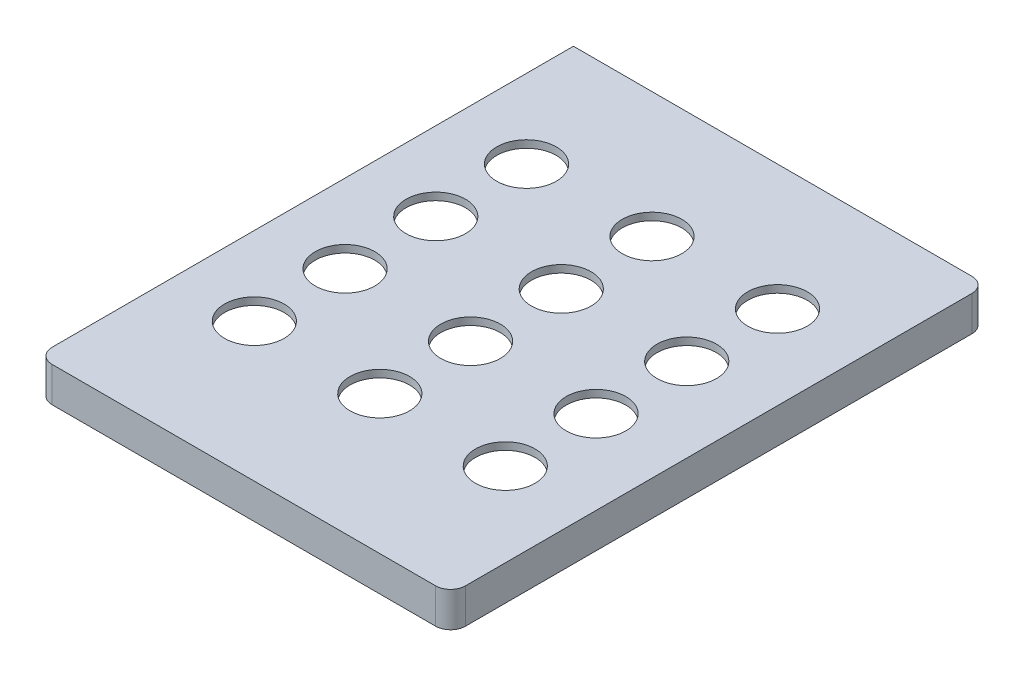
from build123d import *

# Parameters (mm, degrees)
SKETCH11_W          = 51.95
SKETCH11_H          = 64.5
BOSS_EXTRUDE4_DEPTH = 3.7
SKETCH12_R          = 4
BOSS_EXTRUDE5_DEPTH = 1


with BuildPart() as part:
    # Sketch11 → Boss-Extrude4 (new body)
    with BuildSketch(Plane(origin=(0, 12.5, 0), x_dir=(1, 0, 0), z_dir=(0, 1, 0))):
        with BuildLine():
            Line((25.75, 36), (-27.75, 36))
            Line((-27.75, 36), (-27.75, 27.25))
            Line((-27.75, 27.25), (-27.75, 18.75))
            Line((-27.75, 18.75), (-27.75, -34))
            ThreePointArc((-27.75, -34), (-27.164213562, -35.414213562), (-25.75, -36))
            Line((-25.75, -36), (25.75, -36))
            ThreePointArc((25.75, -36), (27.164213562, -35.414213562), (27.75, -34))
            Line((27.75, -34), (27.75, 34))
            ThreePointArc((27.75, 34), (27.164213562, 35.414213562), (25.75, 36))
        make_face()
        with Locations((-0.525, 1.75)):
            Rectangle(SKETCH11_W, SKETCH11_H, mode=Mode.SUBTRACT)
    extrude(amount=BOSS_EXTRUDE4_DEPTH)

    # Sketch12 → Boss-Extrude5 (add)
    with BuildSketch(Plane(origin=(0, 16.2, 0), x_dir=(1, 0, 0), z_dir=(0, 1, 0))):
        with BuildLine():
            Line((-25.75, -36), (25.75, -36))
            ThreePointArc((25.75, -36), (27.164213562, -35.414213562), (27.75, -34))
            Line((27.75, -34), (27.75, 34))
            ThreePointArc((27.75, 34), (27.164213562, 35.414213562), (25.75, 36))
            Line((25.75, 36), (-27.75, 36))
            Line((-27.75, 36), (-27.75, -34))
            ThreePointArc((-27.75, -34), (-27.164213562, -35.414213562), (-25.75, -36))
        make_face()
        with Locations((-17.2, -17.4)):
            Circle(SKETCH12_R, mode=Mode.SUBTRACT)
        with Locations((-17.2, -5.216666667)):
            Circle(SKETCH12_R, mode=Mode.SUBTRACT)
        with Locations((-17.2, 6.966666667)):
            Circle(SKETCH12_R, mode=Mode.SUBTRACT)
        with Locations((-17.2, 19.15)):
            Circle(SKETCH12_R, mode=Mode.SUBTRACT)
        with Locations((-0.35, 19.15)):
            Circle(SKETCH12_R, mode=Mode.SUBTRACT)
        with Locations((-0.35, 6.966666667)):
            Circle(SKETCH12_R, mode=Mode.SUBTRACT)
        with Locations((-0.35, -5.216666667)):
            Circle(SKETCH12_R, mode=Mode.SUBTRACT)
        with Locations((-0.35, -17.4)):
            Circle(SKETCH12_R, mode=Mode.SUBTRACT)
        with Locations((16.5, -17.4)):
            Circle(SKETCH12_R, mode=Mode.SUBTRACT)
        with Locations((16.5, -5.216666667)):
            Circle(SKETCH12_R, mode=Mode.SUBTRACT)
        with Locations((16.5, 6.966666667)):
            Circle(SKETCH12_R, mode=Mode.SUBTRACT)
        with Locations((16.5, 19.15)):
            Circle(SKETCH12_R, mode=Mode.SUBTRACT)
    extrude(amount=BOSS_EXTRUDE5_DEPTH)


solid = part.part
